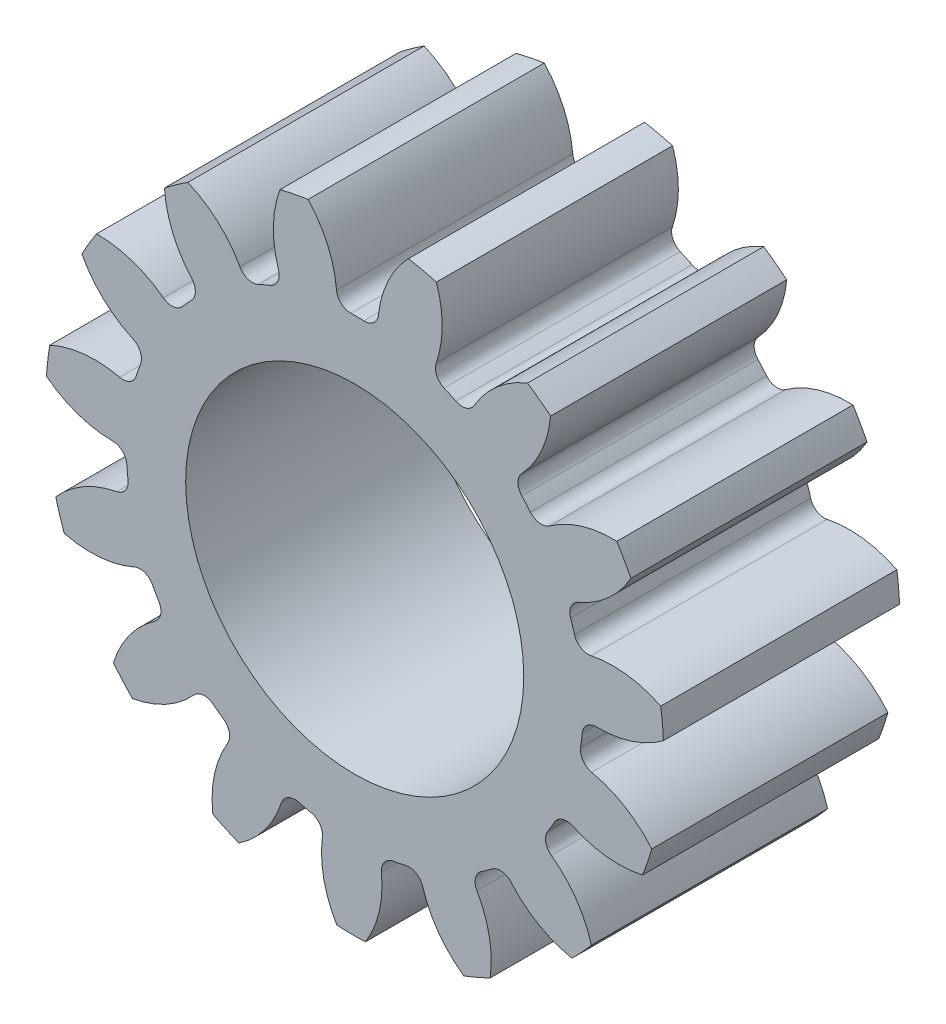
from build123d import *

# Parameters (mm, degrees)
SKETCH3_R         = 21.59
GEARBODY_DEPTH    = 11
TOOTHCUT_DEPTH    = 33.453908855
CIRPATTERN1_COUNT = 15
SCALE1_SCALE_X    = 0.666666667
SCALE1_SCALE_Y    = 0.666666667
SCALE1_SCALE_Z    = 1
BOREDIA_R         = 7.874
BORE_DEPTH        = 12700


with BuildPart() as part:
    # Sketch3 → gearBody (new body)
    with BuildSketch(Plane.XY):
        Circle(SKETCH3_R)
    extrude(amount=GEARBODY_DEPTH)

    # Sketch2 → toothCut (cut, through all)
    with BuildSketch(Plane.XY):
        with BuildLine():
            ThreePointArc((15.783846764, -2.304552616), (15.843293638, -1.852249483), (15.889781974, -1.39843136))
            ThreePointArc((15.889781974, -1.39843136), (16.213055843, -0.751556907), (16.890861518, -0.499501321))
            ThreePointArc((16.890861518, -0.499501321), (20.504912911, 0.340315353), (23.283949955, 2.798691365))
            ThreePointArc((23.283949955, 2.798691365), (23.292901215, -2.723187818), (22.010467945, -8.09409042))
            ThreePointArc((22.010467945, -8.09409042), (19.873444675, -5.060974685), (16.550574786, -3.410158156))
            ThreePointArc((16.550574786, -3.410158156), (15.949189176, -3.008551507), (15.783846764, -2.304552616))
        make_face()
    toothcut = extrude(amount=TOOTHCUT_DEPTH, mode=Mode.SUBTRACT)

    # CirPattern1: toothCut ×15 about axis
    cirpattern1_axis = Axis((0, 0, 11), (0, 0, -1))
    for i in range(1, CIRPATTERN1_COUNT):
        add(toothcut.rotate(cirpattern1_axis, i * 360 / CIRPATTERN1_COUNT), mode=Mode.SUBTRACT)


with BuildPart() as part_1:
    # Scale1: scaled about (0, 0, 5.5)
    add(part.part.scale((SCALE1_SCALE_X, SCALE1_SCALE_Y, SCALE1_SCALE_Z), about=(0, 0, 5.5)))

    # boreDia → bore (cut, symmetric)
    with BuildSketch(Plane.XY):
        Circle(BOREDIA_R)
    extrude(amount=BORE_DEPTH, both=True, mode=Mode.SUBTRACT)


solid = part_1.part
